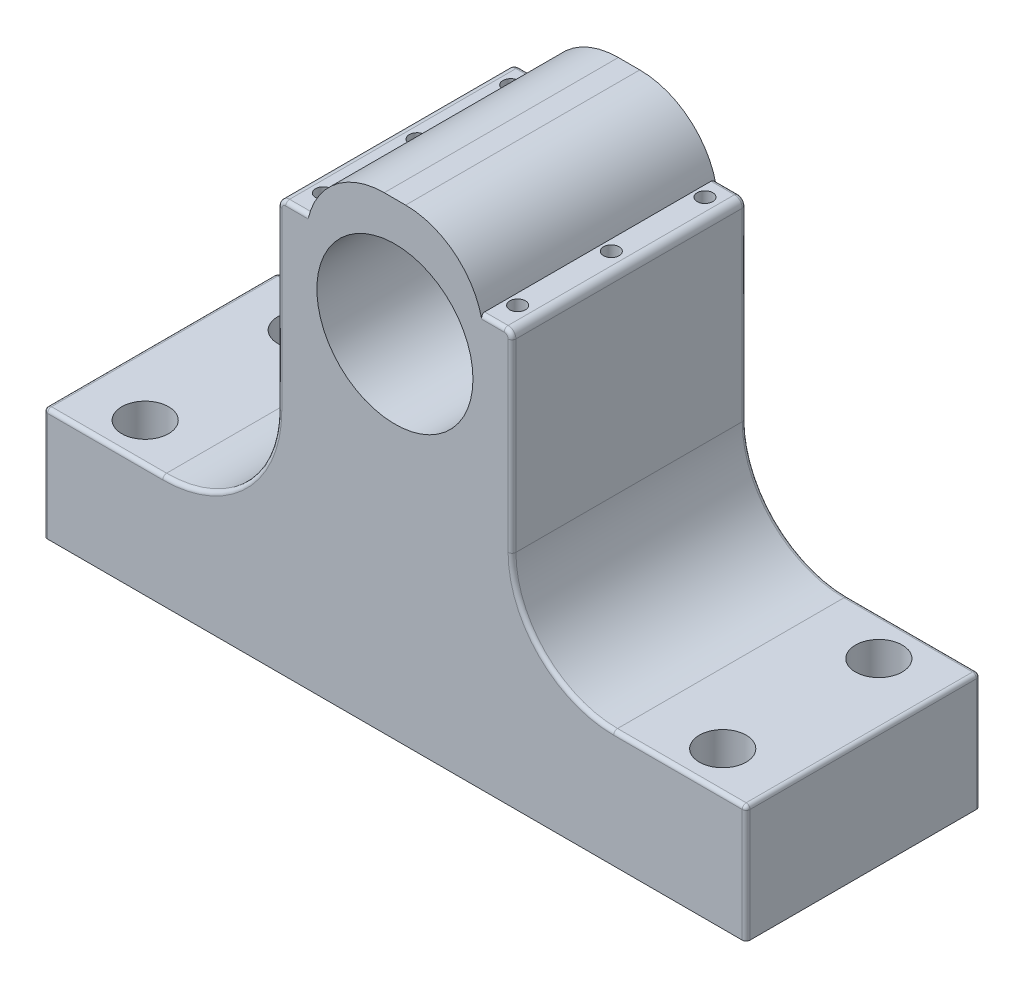
from build123d import *

# Parameters (mm, degrees)
ESQUISSE1_R                = 100
BOSS_EXTRU_1_DEPTH         = 300
ESQUISSE2_R                = 30
ENL_V_MAT_EXTRU_1_DEPTH    = 300
CONG_3_R                   = 100
CONG_4_R                   = 10
ESQUISSE3_R                = 30
ENL_V_MAT_EXTRU_2_DEPTH    = 300
ESQUISSE4_R                = 10
ENL_V_MAT_EXTRU_3_DEPTH    = 100
R_P_TITION_LIN_AIRE1_COUNT = 3
R_P_TITION_LIN_AIRE1_PITCH = 120
CONG_5_R                   = 5


with BuildPart() as part:
    # Esquisse1 → Boss.-Extru.1 (new body)
    with BuildSketch(Plane.XY):
        with BuildLine():
            Line((0, 0), (900, 0))
            Line((900, 0), (900, 150))
            Line((900, 150), (730.278028845, 150))
            ThreePointArc((730.278028845, 150), (638.157551209, 188.157551209), (600, 280.278028845))
            Line((600, 280.278028845), (600, 375))
            Line((600, 375), (600, 527.089712385))
            Line((600, 527.089712385), (560, 527.089712385))
            Line((560, 527.089712385), (560, 600))
            Line((560, 600), (340, 600))
            Line((340, 600), (340, 527.089712385))
            Line((340, 527.089712385), (300, 527.089712385))
            Line((300, 527.089712385), (300, 375))
            Line((300, 375), (300, 291.936386231))
            ThreePointArc((300, 291.936386231), (256.792071963, 187.623220362), (152.478906094, 144.415292325))
            Line((152.478906094, 144.415292325), (0, 144.415292325))
            Line((0, 144.415292325), (0, 0))
        make_face()
        with Locations((450, 450)):
            Circle(ESQUISSE1_R, mode=Mode.SUBTRACT)
    extrude(amount=-BOSS_EXTRU_1_DEPTH)

    # Esquisse2 → Enlèv. mat.-Extru.1 (cut)
    with BuildSketch(Plane(origin=(0, 144.415292325, 0), x_dir=(1, 0, 0), z_dir=(0, 1, 0))):
        with Locations(Location((80, 250, 0), (0, 0, 270))):
            Circle(ESQUISSE2_R)
        with Locations(Location((80, 50, 0), (0, 0, 270))):
            Circle(ESQUISSE2_R)
    extrude(amount=-ENL_V_MAT_EXTRU_1_DEPTH, mode=Mode.SUBTRACT)

    # Congé3
    # the kernel refuses this fillet: 100 mm, written as the material it takes off along each edge
    with BuildSketch(Plane(origin=(340, 600, 240.652076177), x_dir=(1, 0, 0), z_dir=(0, 0, -1))) as cong_3_piece_1:
        with BuildLine():
            CenterArc((96.260830471, 100), CONG_3_R, 195.717657912, 74.282342088)
            Line((0, 72.910287615), (-1.925216609, 72.368493368))
            ThreePointArc((-1.925216609, 72.368493368), (-2, 36.455143808), (-2, 0))
            Line((-2, 0), (0, -2))
            Line((0, -2), (96.260830471, -2))
            Line((96.260830471, -2), (96.260830471, 0))
        make_face()
    extrude(amount=781.304152354, mode=Mode.SUBTRACT)
    with BuildSketch(Plane(origin=(560, 600, 240.652076177), x_dir=(0, -1, 0), z_dir=(0, 0, -1))) as cong_3_piece_2:
        with BuildLine():
            CenterArc((100, 96.260830471), CONG_3_R, 180, 74.282342088)
            Line((0, 96.260830471), (-2, 96.260830471))
            Line((-2, 96.260830471), (-2, 0))
            Line((-2, 0), (0, -2))
            ThreePointArc((0, -2), (36.455143808, -2), (72.368493368, -1.925216609))
            Line((72.368493368, -1.925216609), (72.910287615, 0))
        make_face()
    extrude(amount=781.304152354, mode=Mode.SUBTRACT)

    # Congé4
    cong_4_edges = [part.edges().sort_by_distance(p)[0] for p in [
        (300, 527.089712385, -150),
        (600, 527.089712385, -150),
    ]]
    fillet(cong_4_edges, radius=CONG_4_R)

    # Esquisse3 → Enlèv. mat.-Extru.2 (cut)
    with BuildSketch(Plane(origin=(0, 150, 0), x_dir=(1, 0, 0), z_dir=(0, 1, 0))):
        with Locations(Location((820, 250, 0), (0, 0, 270))):
            Circle(ESQUISSE3_R)
        with Locations(Location((820, 50, 0), (0, 0, 270))):
            Circle(ESQUISSE3_R)
    extrude(amount=-ENL_V_MAT_EXTRU_2_DEPTH, mode=Mode.SUBTRACT)

    # Esquisse4 → Enlèv. mat.-Extru.3 (cut)
    with BuildSketch(Plane(origin=(0, 527.089712385, 0), x_dir=(1, 0, 0), z_dir=(0, 1, 0))):
        with Locations(Location((573.784271885, 273.452208884, 0), (0, 0, 270))):
            Circle(ESQUISSE4_R)
        with Locations(Location((324.885406348, 273.452208884, 0), (0, 0, 270))):
            Circle(ESQUISSE4_R)
    enl_v_mat_extru_3 = extrude(amount=-ENL_V_MAT_EXTRU_3_DEPTH, mode=Mode.SUBTRACT)

    # Répétition linéaire1: Enlèv. mat.-Extru.3 ×3
    with Locations(*[(0, 0, i * R_P_TITION_LIN_AIRE1_PITCH) for i in range(1, R_P_TITION_LIN_AIRE1_COUNT)]):
        add(enl_v_mat_extru_3, mode=Mode.SUBTRACT)

    # Congé5
    cong_5_edges = [part.edges().sort_by_distance(p)[0] for p in [
        (900, 75, -300),
        (76.239453047, 144.415292325, 0),
        (256.792071963, 187.623220362, 0),
        (815.139014422, 150, -300),
        (325, 527.089712385, 0),
        (600, 398.683870615, 0),
        (638.157551209, 188.157551209, 0),
        (815.139014422, 150, 0),
        (638.157551209, 188.157551209, -300),
        (900, 75, 0),
        (0, 72.207646162, 0),
        (600, 398.683870615, -300),
        (0, 144.415292325, -150),
        (900, 150, -150),
        (325, 527.089712385, -300),
        (0, 72.207646162, -300),
        (256.792071963, 187.623220362, -300),
        (76.239453047, 144.415292325, -300),
        (300, 404.513049308, 0),
        (575, 527.089712385, 0),
        (597.071067812, 524.160780197, 0),
        (302.928932188, 524.160780197, 0),
        (300, 404.513049308, -300),
        (575, 527.089712385, -300),
        (597.071067812, 524.160780197, -300),
        (302.928932188, 524.160780197, -300),
    ]]
    fillet(cong_5_edges, radius=CONG_5_R)


solid = part.part
